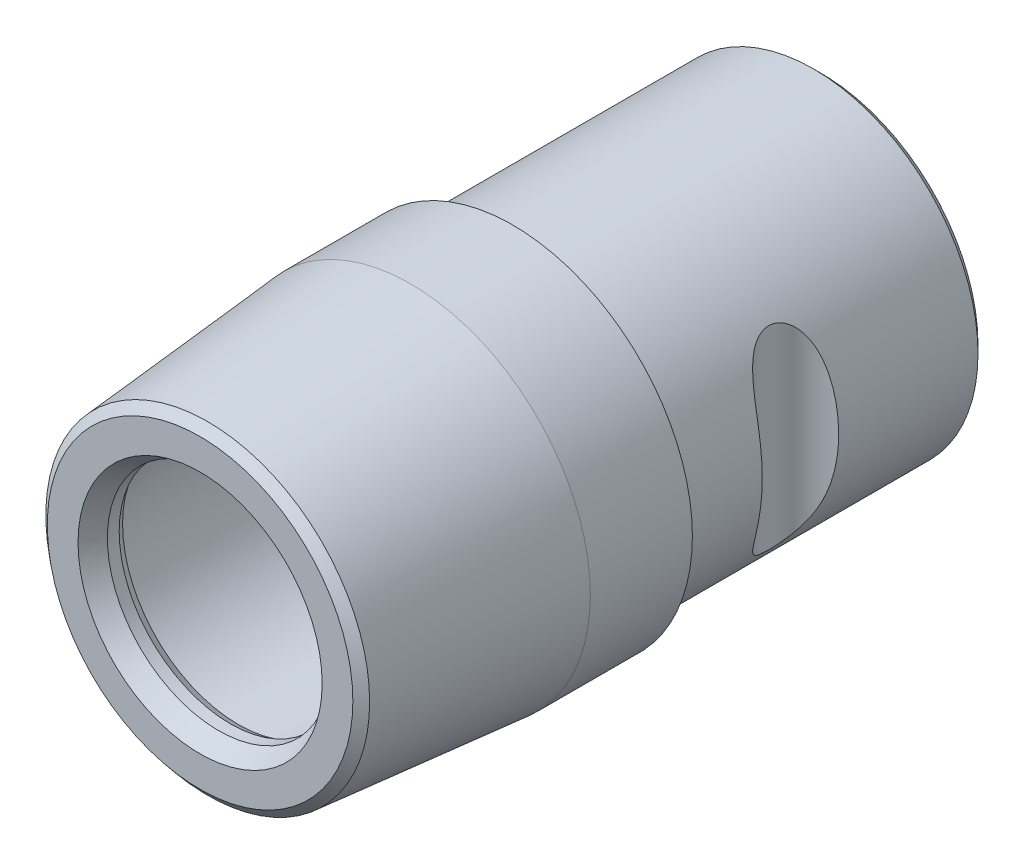
from build123d import *

# Parameters (mm, degrees)
CHAMFER1_SIZE           = 0.3
CHAMFER1_SIZE2          = 0.519615242
CHAMFER3_SIZE           = 1.2
CHAMFER3_SIZE2          = 13.716062763
CHAMFER2_SIZE           = 0.7
CHAMFER2_SIZE2          = 1.212435565
CUT_EXTRUDE1_DEPTH      = 44.71491629
CUT_EXTRUDE1_DEPTH_BACK = 44.71491629
SKETCH3_R               = 2.53125
CHAMFER4_SIZE           = 0.5
CHAMFER5_SIZE           = 0.5
CHAMFER5_SIZE2          = 0.550031434


with BuildPart() as part:
    # Sketch1 → Revolve1 (revolve)
    with BuildSketch(Plane(origin=(0, 0, 0), x_dir=(1, 0, 0), z_dir=(0, 1, 0))):
        with BuildLine():
            Line((10.7, 0), (10.7, -20.1))
            Line((10.7, -20.1), (11.7, -20.1))
            Line((11.7, -20.1), (11.7, -40.4625))
            Line((11.7, -40.4625), (7.25, -40.4625))
            Line((7.25, -40.4625), (7.25, -37.9625))
            Line((7.25, -37.9625), (8.25, -37.9625))
            Line((8.25, -37.9625), (8.25, -27.8225))
            Line((8.25, -27.8225), (8.94, -27.8225))
            ThreePointArc((8.94, -27.8225), (9.642148445, -27.353339409), (9.477401154, -26.525098846))
            Line((9.477401154, -26.525098846), (8.25, -25.297697693))
            Line((8.25, -25.297697693), (8.25, -4.8225))
            Line((8.25, -4.8225), (8.94, -4.8225))
            ThreePointArc((8.94, -4.8225), (9.642148445, -4.353339409), (9.477401154, -3.525098846))
            Line((9.477401154, -3.525098846), (8.25, -2.297697693))
            Line((8.25, -2.297697693), (8.25, 0))
            Line((8.25, 0), (10.7, 0))
        make_face()
    revolve(axis=Axis((0, 0, 37.4625), (0, 0, -1)))

    # Chamfer1
    chamfer1_edges = [part.edges().sort_by_distance(p)[0] for p in [
        (-7.25, 0, 37.9625),
    ]]
    chamfer1_side = [part.faces().sort_by_distance(p)[0] for p in [
        (-7.483345238, 0, 37.9625),
    ]]
    chamfer(chamfer1_edges, length=CHAMFER1_SIZE, length2=CHAMFER1_SIZE2, reference=chamfer1_side[0])

    # Chamfer3
    chamfer3_edges = [part.edges().sort_by_distance(p)[0] for p in [
        (-11.7, 0, 40.4625),
    ]]
    chamfer3_side = [part.faces().sort_by_distance(p)[0] for p in [
        (-11.369074026, 0, 40.4625),
    ]]
    chamfer(chamfer3_edges, length=CHAMFER3_SIZE, length2=CHAMFER3_SIZE2, reference=chamfer3_side[0])

    # Chamfer2
    chamfer2_edges = [part.edges().sort_by_distance(p)[0] for p in [
        (-7.25, 0, 40.4625),
    ]]
    chamfer2_side = [part.faces().sort_by_distance(p)[0] for p in [
        (-10.203015152, 0, 40.4625),
    ]]
    chamfer(chamfer2_edges, length=CHAMFER2_SIZE, length2=CHAMFER2_SIZE2, reference=chamfer2_side[0])

    # Sketch3 → Cut-Extrude1 (cut, two sides: drawn at the far end of the back side and taken through both)
    with BuildSketch(Plane(origin=(0, 0, 0), x_dir=(1, 0, 0), z_dir=(0, 1, 0)).offset(-CUT_EXTRUDE1_DEPTH_BACK)):
        with Locations((11.166, -12.0625)):
            Circle(SKETCH3_R)
    extrude(amount=CUT_EXTRUDE1_DEPTH + CUT_EXTRUDE1_DEPTH_BACK, mode=Mode.SUBTRACT)

    # Chamfer4
    chamfer4_edges = [part.edges().sort_by_distance(p)[0] for p in [
        (-10.7, 0, 0),
        (-8.25, 0, 0),
    ]]
    chamfer(chamfer4_edges, length=CHAMFER4_SIZE)

    # Chamfer5
    chamfer5_edges = [part.edges().sort_by_distance(p)[0] for p in [
        (-10.5, 0, 40.4625),
    ]]
    chamfer5_side = [part.faces().sort_by_distance(p)[0] for p in [
        (-11.1, 0, 33.604468618),
    ]]
    chamfer(chamfer5_edges, length=CHAMFER5_SIZE, length2=CHAMFER5_SIZE2, reference=chamfer5_side[0])


solid = part.part
